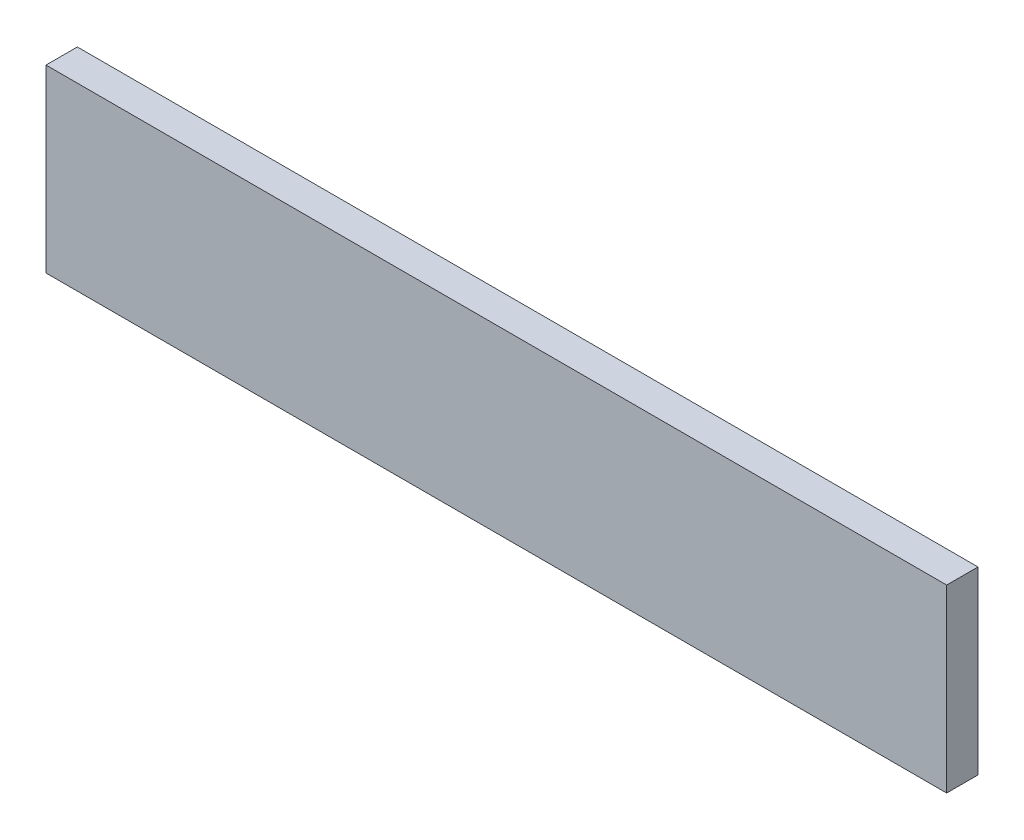
from build123d import *

# Parameters (mm, degrees)
IZIM1_W            = 1150
IZIM1_H            = 230
TABAN_FLAN_1_DEPTH = 40


# Sheet-metal steps are written as plain solids
with BuildPart() as part:
    # Çizim1 → Taban-Flanş1 (new body)
    with BuildSketch(Plane.XY):
        with Locations((575, -115)):
            Rectangle(IZIM1_W, IZIM1_H)
    extrude(amount=-TABAN_FLAN_1_DEPTH)


solid = part.part
